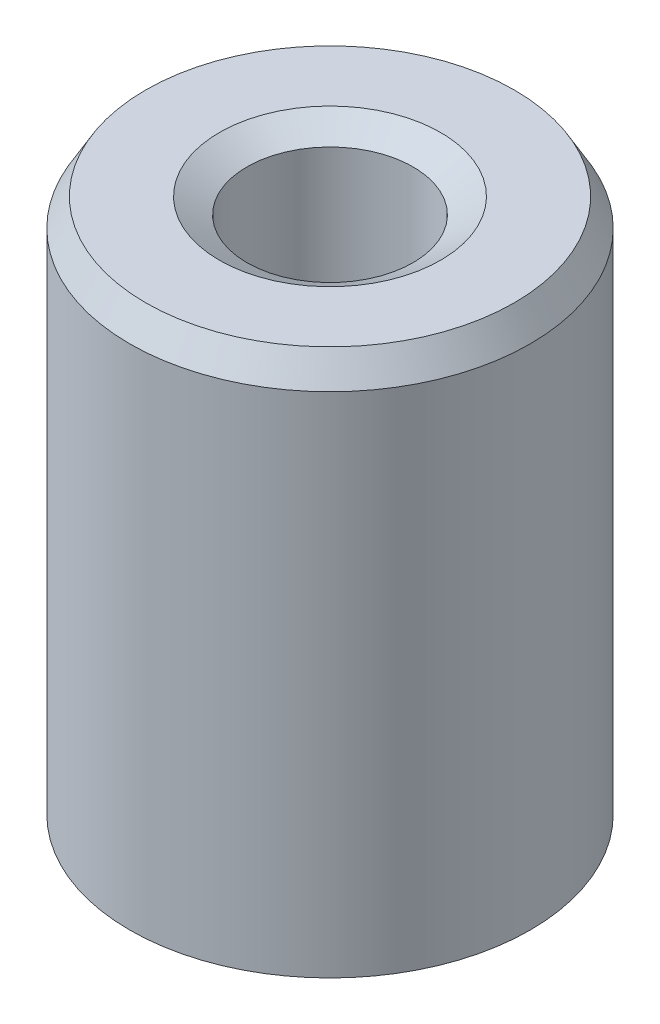
from build123d import *
from OCP.BRepFilletAPI import BRepFilletAPI_MakeChamfer

# Parameters (mm, degrees)
SKETCH1_R           = 22.5
BOSS_EXTRUDE1_DEPTH = 61.934558299
SKETCH2_R           = 9.331752823
CUT_EXTRUDE1_DEPTH  = 70.630377794
CHAMFER1_SIZE       = 3.101088129
CHAMFER1_SIZE2      = 1.790414066


with BuildPart() as part:
    # Sketch1 → Boss-Extrude1 (new body)
    with BuildSketch(Plane(origin=(0, 0, 0), x_dir=(1, 0, 0), z_dir=(0, 1, 0))):
        Circle(SKETCH1_R)
    extrude(amount=BOSS_EXTRUDE1_DEPTH)

    # Sketch2 → Cut-Extrude1 (cut, through all)
    with BuildSketch(Plane(origin=(0, 0, 0), x_dir=(1, 0, 0), z_dir=(0, 1, 0))):
        Circle(SKETCH2_R)
    extrude(amount=CUT_EXTRUDE1_DEPTH, mode=Mode.SUBTRACT)

    # Chamfer1: one chamfer whose edges measure the first distance from different faces: ONE call of the kernel's chamfer builder (chamfer() names one face for all edges)
    chamfer1_edges_1 = [part.edges().sort_by_distance(p)[0] for p in [
        (-9.331752823, 61.934558299, 0),
    ]]
    chamfer1_side_1 = [part.faces().sort_by_distance(p)[0] for p in [
        (-21.863603897, 61.934558299, 0),
    ]]
    chamfer1_edges_2 = [part.edges().sort_by_distance(p)[0] for p in [
        (-9.331752823, 0, 0),
    ]]
    chamfer1_side_2 = [part.faces().sort_by_distance(p)[0] for p in [
        (-9.331752823, 30.967279149, 0),
    ]]
    chamfer1_edges_3 = [part.edges().sort_by_distance(p)[0] for p in [
        (-22.5, 0, 0),
    ]]
    chamfer1_side_3 = [part.faces().sort_by_distance(p)[0] for p in [
        (-21.863603897, 0, 0),
    ]]
    chamfer1_edges_4 = [part.edges().sort_by_distance(p)[0] for p in [
        (-22.5, 61.934558299, 0),
    ]]
    chamfer1_side_4 = [part.faces().sort_by_distance(p)[0] for p in [
        (-22.5, 30.967279149, 0),
    ]]
    chamfer1 = BRepFilletAPI_MakeChamfer(part.part.solid().wrapped)
    for e in chamfer1_edges_1:
        chamfer1.Add(CHAMFER1_SIZE, CHAMFER1_SIZE2, e.wrapped, chamfer1_side_1[0].wrapped)  # the first distance lies on this face
    for e in chamfer1_edges_2:
        chamfer1.Add(CHAMFER1_SIZE, CHAMFER1_SIZE2, e.wrapped, chamfer1_side_2[0].wrapped)  # the first distance lies on this face
    for e in chamfer1_edges_3:
        chamfer1.Add(CHAMFER1_SIZE, CHAMFER1_SIZE2, e.wrapped, chamfer1_side_3[0].wrapped)  # the first distance lies on this face
    for e in chamfer1_edges_4:
        chamfer1.Add(CHAMFER1_SIZE, CHAMFER1_SIZE2, e.wrapped, chamfer1_side_4[0].wrapped)  # the first distance lies on this face
    add(Compound.cast(chamfer1.Shape()), mode=Mode.REPLACE)


solid = part.part
